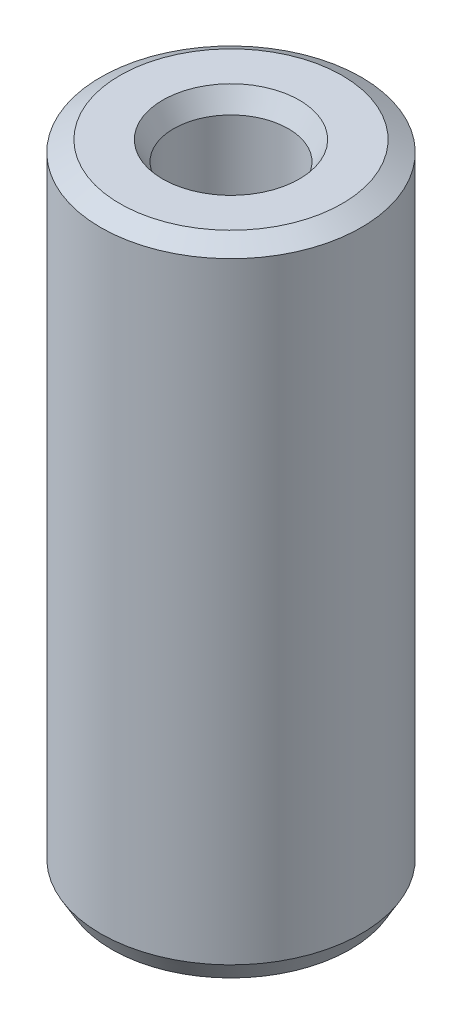
from build123d import *
from OCP.BRepFilletAPI import BRepFilletAPI_MakeChamfer

# Parameters (mm, degrees)
SKETCH1_R           = 40
BOSS_EXTRUDE1_DEPTH = 197.049070376
SKETCH2_R           = 17.593769761
CUT_EXTRUDE1_DEPTH  = 206.008136756
CHAMFER1_SIZE       = 3.399044152
CHAMFER1_SIZE2      = 5.887317168


with BuildPart() as part:
    # Sketch1 → Boss-Extrude1 (new body)
    with BuildSketch(Plane(origin=(0, 0, 0), x_dir=(1, 0, 0), z_dir=(0, 1, 0))):
        Circle(SKETCH1_R)
    extrude(amount=BOSS_EXTRUDE1_DEPTH)

    # Sketch2 → Cut-Extrude1 (cut, through all)
    with BuildSketch(Plane(origin=(0, 0, 0), x_dir=(1, 0, 0), z_dir=(0, 1, 0))):
        Circle(SKETCH2_R)
    extrude(amount=CUT_EXTRUDE1_DEPTH, mode=Mode.SUBTRACT)

    # Chamfer1: one chamfer whose edges measure the first distance from different faces: ONE call of the kernel's chamfer builder (chamfer() names one face for all edges)
    chamfer1_edges_1 = [part.edges().sort_by_distance(p)[0] for p in [
        (-17.593769761, 197.049070376, 0),
    ]]
    chamfer1_side_1 = [part.faces().sort_by_distance(p)[0] for p in [
        (-38.86862915, 197.049070376, 0),
    ]]
    chamfer1_edges_2 = [part.edges().sort_by_distance(p)[0] for p in [
        (-17.593769761, 0, 0),
    ]]
    chamfer1_side_2 = [part.faces().sort_by_distance(p)[0] for p in [
        (-17.593769761, 98.524535188, 0),
    ]]
    chamfer1_edges_3 = [part.edges().sort_by_distance(p)[0] for p in [
        (-40, 0, 0),
    ]]
    chamfer1_side_3 = [part.faces().sort_by_distance(p)[0] for p in [
        (-38.86862915, 0, 0),
    ]]
    chamfer1_edges_4 = [part.edges().sort_by_distance(p)[0] for p in [
        (-40, 197.049070376, 0),
    ]]
    chamfer1_side_4 = [part.faces().sort_by_distance(p)[0] for p in [
        (-40, 98.524535188, 0),
    ]]
    chamfer1 = BRepFilletAPI_MakeChamfer(part.part.solid().wrapped)
    for e in chamfer1_edges_1:
        chamfer1.Add(CHAMFER1_SIZE, CHAMFER1_SIZE2, e.wrapped, chamfer1_side_1[0].wrapped)  # the first distance lies on this face
    for e in chamfer1_edges_2:
        chamfer1.Add(CHAMFER1_SIZE, CHAMFER1_SIZE2, e.wrapped, chamfer1_side_2[0].wrapped)  # the first distance lies on this face
    for e in chamfer1_edges_3:
        chamfer1.Add(CHAMFER1_SIZE, CHAMFER1_SIZE2, e.wrapped, chamfer1_side_3[0].wrapped)  # the first distance lies on this face
    for e in chamfer1_edges_4:
        chamfer1.Add(CHAMFER1_SIZE, CHAMFER1_SIZE2, e.wrapped, chamfer1_side_4[0].wrapped)  # the first distance lies on this face
    add(Compound.cast(chamfer1.Shape()), mode=Mode.REPLACE)


solid = part.part
